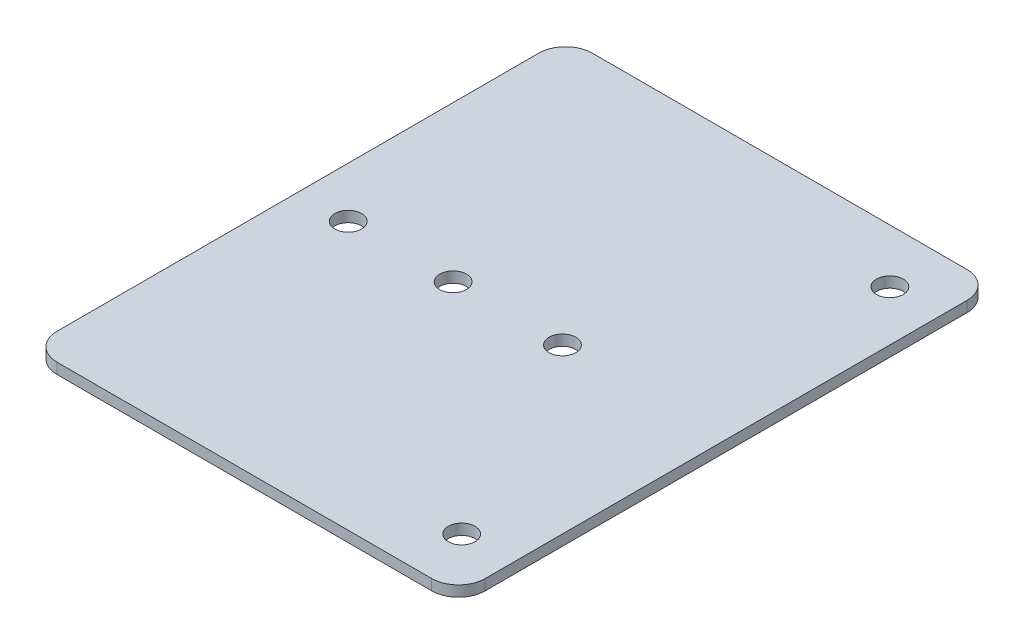
from build123d import *

# Parameters (mm, degrees)
SKETCH1_R           = 2.5
BOSS_EXTRUDE1_DEPTH = 2


with BuildPart() as part:
    # Sketch1 → Boss-Extrude1 (new body)
    with BuildSketch(Plane(origin=(0, 0, 0), x_dir=(1, 0, 0), z_dir=(0, 1, 0))):
        with BuildLine():
            Line((-35, 50), (35, 50))
            ThreePointArc((35, 50), (38.535533906, 48.535533906), (40, 45))
            Line((40, 45), (40, -45))
            ThreePointArc((40, -45), (38.535533906, -48.535533906), (35, -50))
            Line((35, -50), (-35, -50))
            ThreePointArc((-35, -50), (-38.535533906, -48.535533906), (-40, -45))
            Line((-40, -45), (-40, 45))
            ThreePointArc((-40, 45), (-38.535533906, 48.535533906), (-35, 50))
        make_face()
        with Locations((-30.6, 0)):
            Circle(SKETCH1_R, mode=Mode.SUBTRACT)
        with Locations((30.6, 40)):
            Circle(SKETCH1_R, mode=Mode.SUBTRACT)
        with Locations((30.6, -40)):
            Circle(SKETCH1_R, mode=Mode.SUBTRACT)
        with Locations((9.42, 0)):
            Circle(SKETCH1_R, mode=Mode.SUBTRACT)
        with Locations((-11, 0)):
            Circle(SKETCH1_R, mode=Mode.SUBTRACT)
    extrude(amount=BOSS_EXTRUDE1_DEPTH)


solid = part.part
